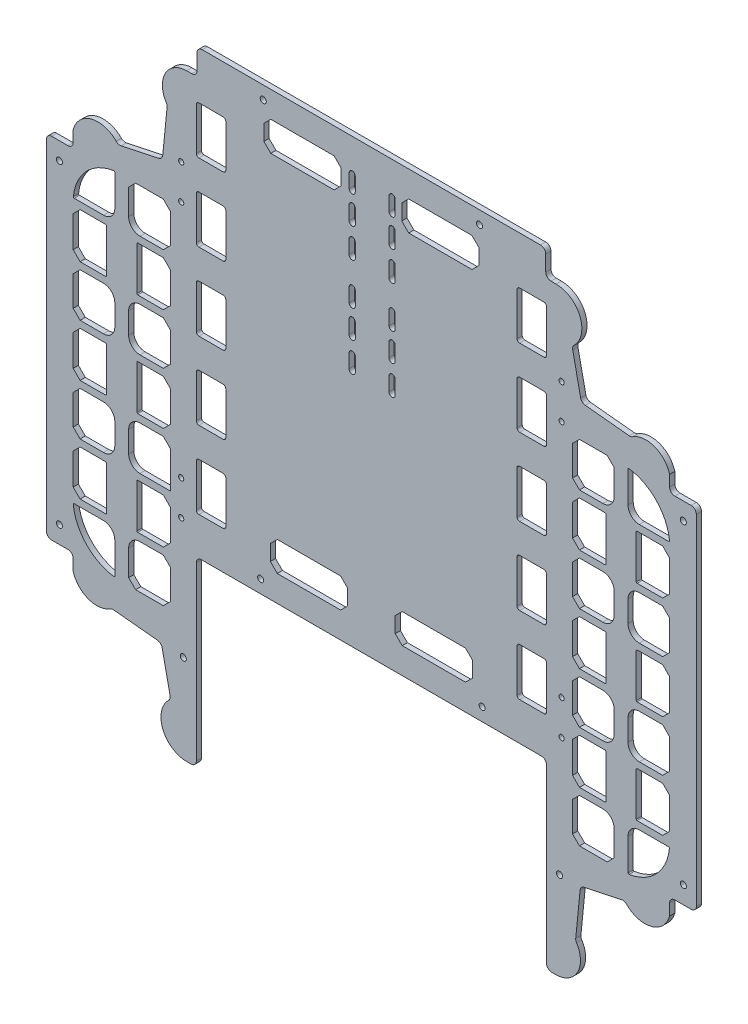
from build123d import *

# Parameters (mm, degrees)
RESSALTO_EXTRUS_O1_DEPTH = 6
FILETE1_R                = 6
CORTE_EXTRUS_O1_DEPTH    = 10
FILETE2_R                = 6
ESBO_O4_W                = 38.482345016
ESBO_O4_H                = 52
ESBO_O4_W_2              = 38.482345017
CORTE_EXTRUS_O2_DEPTH    = 931.073254939
FILETE3_R                = 55
FILETE4_R                = 13
CHANFRO1_SIZE            = 8
FILETE5_R                = 1
ESBO_O8_W                = 34
ESBO_O8_H                = 55
CORTE_EXTRUS_O4_DEPTH    = 931.073254939
FILETE6_R                = 3
ESBO_O9_W                = 89
ESBO_O9_H                = 34
CORTE_EXTRUS_O5_DEPTH    = 931.073254939
CHANFRO2_SIZE            = 8
CHANFRO3_SIZE            = 8
CORTE_EXTRUS_O6_DEPTH    = 931.073254939
ESBO_O11_R               = 3
CORTE_EXTRUS_O7_DEPTH    = 931.073254939
ESBO_O12_R               = 3.5
CORTE_EXTRUS_O8_DEPTH    = 931.073254939


with BuildPart() as part:
    # Esboço1 → Ressalto-extrusão1 (new body)
    with BuildSketch(Plane.XY):
        with BuildLine():
            Line((306.342806047, -674.493319609), (275.520600999, -674.493319609))
            Line((275.520600999, -674.493319609), (275.520600999, -717.778646353))
            Line((275.520600999, -717.778646353), (233.520600999, -717.778646353))
            ThreePointArc((233.520600999, -717.778646353), (192.534924195, -734.755469548), (175.558100999, -775.741146353))
            Line((175.558100999, -775.741146353), (175.558100999, -817.741146353))
            Line((175.558100999, -817.741146353), (133.558100999, -817.741146353))
            Line((133.558100999, -817.741146353), (133.558100999, -607.741146353))
            Line((133.558100999, -607.741146353), (-270.272488906, -607.741146353))
            Line((-270.272488906, -607.741146353), (-270.272488906, -817.741146353))
            Line((-270.272488906, -817.741146353), (-312.272488906, -817.741146353))
            Line((-312.272488906, -817.741146353), (-312.272488906, -775.741146353))
            ThreePointArc((-312.272488906, -775.741146353), (-329.249312101, -734.755469548), (-370.234988906, -717.778646353))
            Line((-370.234988906, -717.778646353), (-412.234988906, -717.778646353))
            Line((-412.234988906, -717.778646353), (-412.234988906, -674.493319609))
            Line((-412.234988906, -674.493319609), (-443.057193953, -674.493319609))
            Line((-443.057193953, -674.493319609), (-443.057193953, -271.188973097))
            Line((-443.057193953, -271.188973097), (-412.234988906, -271.188973097))
            Line((-412.234988906, -271.188973097), (-412.234988906, -227.903646353))
            Line((-412.234988906, -227.903646353), (-370.234988906, -227.903646353))
            ThreePointArc((-370.234988906, -227.903646353), (-329.249312101, -210.926823158), (-312.272488906, -169.941146353))
            Line((-312.272488906, -169.941146353), (-312.272488906, -127.941146353))
            Line((-312.272488906, -127.941146353), (-270.272488906, -127.941146353))
            Line((-270.272488906, -127.941146353), (-269.391871615, -127.941146353))
            Line((-269.391871615, -127.941146353), (-269.391871615, -97.941146353))
            Line((-269.391871615, -97.941146353), (132.677483708, -97.941146353))
            Line((132.677483708, -97.941146353), (132.677483708, -127.941146353))
            Line((132.677483708, -127.941146353), (133.558100999, -127.941146353))
            Line((133.558100999, -127.941146353), (175.558100999, -127.941146353))
            Line((175.558100999, -127.941146353), (175.558100999, -169.941146353))
            ThreePointArc((175.558100999, -169.941146353), (192.534924195, -210.926823158), (233.520600999, -227.903646353))
            Line((233.520600999, -227.903646353), (275.520600999, -227.903646353))
            Line((275.520600999, -227.903646353), (275.520600999, -271.188973097))
            Line((275.520600999, -271.188973097), (306.342806047, -271.188973097))
            Line((306.342806047, -271.188973097), (306.342806047, -674.493319609))
        make_face()
    extrude(amount=RESSALTO_EXTRUS_O1_DEPTH)

    # Filete1
    filete1_edges = [part.edges().sort_by_distance(p)[0] for p in [
        (306.342806047, -674.493319609, 3),
        (275.520600999, -674.493319609, 3),
        (275.520600999, -717.778646353, 3),
        (175.558100999, -817.741146353, 3),
        (133.558100999, -817.741146353, 3),
        (133.558100999, -607.741146353, 3),
        (-270.272488906, -607.741146353, 3),
        (-270.272488906, -817.741146353, 3),
        (-312.272488906, -817.741146353, 3),
        (-412.234988906, -717.778646353, 3),
        (-412.234988906, -674.493319609, 3),
        (-443.057193953, -674.493319609, 3),
        (-443.057193953, -271.188973097, 3),
        (-412.234988906, -271.188973097, 3),
        (-412.234988906, -227.903646353, 3),
        (-312.272488906, -127.941146353, 3),
        (-269.391871615, -127.941146353, 3),
        (-269.391871615, -97.941146353, 3),
        (132.677483708, -97.941146353, 3),
        (175.558100999, -127.941146353, 3),
        (275.520600999, -227.903646353, 3),
        (275.520600999, -271.188973097, 3),
        (306.342806047, -271.188973097, 3),
    ]]
    fillet(filete1_edges, radius=FILETE1_R)

    # Esboço2 → Corte-extrusão1 (cut)
    with BuildSketch(Plane(origin=(0, 0, 0), x_dir=(-1, 0, 0), z_dir=(0, 0, -1))):
        with BuildLine():
            Line((309.447448128, -230.621094148), (360.422080204, -241.420804334))
            ThreePointArc((360.422080204, -241.420804334), (393.362675526, -231.794749334), (413.257193953, -259.758152052))
            ThreePointArc((413.257193953, -259.758152052), (384.010212601, -157.179553298), (281.423154639, -127.962257404))
            ThreePointArc((281.423154639, -127.962257404), (306.518723232, -143.794354152), (303.702517001, -173.332665426))
            Line((303.702517001, -173.332665426), (309.447448128, -230.621094148))
        make_face()
        with BuildLine():
            Line((310.577246158, -713.931400527), (299.777535973, -764.906032604))
            ThreePointArc((299.777535973, -764.906032604), (309.403590972, -797.846627926), (281.440188254, -817.741146353))
            ThreePointArc((281.440188254, -817.741146353), (384.018787009, -788.494165001), (413.236082902, -685.907107039))
            ThreePointArc((413.236082902, -685.907107039), (397.403986154, -711.002675631), (367.865674881, -708.186469401))
            Line((367.865674881, -708.186469401), (310.577246158, -713.931400527))
        make_face()
        with BuildLine():
            Line((-172.733060221, -715.061198558), (-223.707692298, -704.261488372))
            ThreePointArc((-223.707692298, -704.261488372), (-256.648287619, -713.887543372), (-276.542806047, -685.924140654))
            ThreePointArc((-276.542806047, -685.924140654), (-247.295824695, -788.502739408), (-144.708766733, -817.720035302))
            ThreePointArc((-144.708766733, -817.720035302), (-169.804335325, -801.887938554), (-166.988129095, -772.34962728))
            Line((-166.988129095, -772.34962728), (-172.733060221, -715.061198558))
        make_face()
        with BuildLine():
            Line((-173.862858252, -231.750892179), (-163.063148066, -180.776260102))
            ThreePointArc((-163.063148066, -180.776260102), (-172.689203065, -147.83566478), (-144.725800348, -127.941146353))
            ThreePointArc((-144.725800348, -127.941146353), (-247.304399102, -157.188127705), (-276.521694995, -259.775185667))
            ThreePointArc((-276.521694995, -259.775185667), (-260.689598247, -234.679617075), (-231.151286974, -237.495823305))
            Line((-231.151286974, -237.495823305), (-173.862858252, -231.750892179))
        make_face()
    extrude(amount=-CORTE_EXTRUS_O1_DEPTH, mode=Mode.SUBTRACT)

    # Filete2
    filete2_edges = [part.edges().sort_by_distance(p)[0] for p in [
        (-367.865674881, -708.186469401, 3),
        (-299.777535973, -764.906032604, 3),
        (-310.577246158, -713.931400527, 3),
        (223.707692298, -704.261488372, 3),
        (172.733060221, -715.061198558, 3),
        (166.988129095, -772.34962728, 3),
        (231.151286974, -237.495823305, 3),
        (163.063148066, -180.776260102, 3),
        (173.862858252, -231.750892179, 3),
        (-360.422080204, -241.420804334, 3),
        (-309.447448128, -230.621094148, 3),
        (-303.702517001, -173.332665426, 3),
        (132.677483708, -127.941146353, 3),
    ]]
    fillet(filete2_edges, radius=FILETE2_R)

    # Esboço4 → Corte-extrusão2 (cut, through all)
    with BuildSketch(Plane(origin=(0, 0, 0), x_dir=(-1, 0, 0), z_dir=(0, 0, -1))):
        Polygon((373.754833922, -625.078646353), (364.254833922, -625.078646353), (364.254833922, -675.578646353), (412.237178938, -675.578646353), (412.237178938, -625.078646353), align=None)
        with Locations((392.99600643, -591.078646353)):
            Rectangle(ESBO_O4_W, ESBO_O4_H)
        Polygon((373.754833922, -557.078646353), (364.254833922, -557.078646353), (364.254833922, -506.578646353), (373.754833922, -506.578646353), (412.237178938, -506.578646353), (412.237178938, -557.078646353), align=None)
        with Locations((319.513661414, -591.078646353)):
            Rectangle(ESBO_O4_W, ESBO_O4_H)
        with Locations((392.99600643, -472.578646353)):
            Rectangle(ESBO_O4_W, ESBO_O4_H)
        Polygon((373.754833922, -438.578646353), (364.254833922, -438.578646353), (364.254833922, -388.078646353), (373.754833922, -388.078646353), (412.237178938, -388.078646353), (412.237178938, -438.578646353), align=None)
        with Locations((319.513661414, -472.578646353)):
            Rectangle(ESBO_O4_W, ESBO_O4_H)
        with Locations((392.99600643, -354.078646353)):
            Rectangle(ESBO_O4_W, ESBO_O4_H)
        Polygon((373.754833922, -320.078646353), (364.254833922, -320.078646353), (364.254833922, -269.578646353), (412.237178938, -269.578646353), (412.237178938, -320.078646353), align=None)
        with Locations((319.513661414, -354.078646353)):
            Rectangle(ESBO_O4_W, ESBO_O4_H)
        Polygon((300.272488906, -269.578646353), (348.254833922, -269.578646353), (348.254833922, -320.078646353), (338.754833922, -320.078646353), (300.272488906, -320.078646353), align=None)
        Polygon((300.272488906, -675.578646353), (348.254833922, -675.578646353), (348.254833922, -625.078646353), (338.754833922, -625.078646353), (300.272488906, -625.078646353), align=None)
        Polygon((348.254833922, -438.578646353), (348.254833922, -388.078646353), (338.754833922, -388.078646353), (300.272488906, -388.078646353), (300.272488906, -438.578646353), (338.754833922, -438.578646353), align=None)
        Polygon((348.254833922, -557.078646353), (348.254833922, -506.578646353), (338.754833922, -506.578646353), (300.272488906, -506.578646353), (300.272488906, -557.078646353), (338.754833922, -557.078646353), align=None)
        Polygon((-227.540446015, -675.578646353), (-275.522791032, -675.578646353), (-275.522791032, -625.078646353), (-237.040446015, -625.078646353), (-227.540446015, -625.078646353), align=None)
        Polygon((-163.558100999, -625.078646353), (-163.558100999, -675.578646353), (-211.540446015, -675.578646353), (-211.540446015, -625.078646353), (-202.040446015, -625.078646353), align=None)
        with Locations((-182.799273507, -354.078646353)):
            Rectangle(ESBO_O4_W, ESBO_O4_H)
        with Locations((-182.799273507, -591.078646353)):
            Rectangle(ESBO_O4_W, ESBO_O4_H)
        with Locations((-256.281618524, -354.078646353)):
            Rectangle(ESBO_O4_W_2, ESBO_O4_H)
        with Locations((-256.281618524, -591.078646353)):
            Rectangle(ESBO_O4_W_2, ESBO_O4_H)
        with Locations((-182.799273507, -472.578646353)):
            Rectangle(ESBO_O4_W, ESBO_O4_H)
        Polygon((-275.522791032, -506.578646353), (-275.522791032, -557.078646353), (-237.040446015, -557.078646353), (-227.540446015, -557.078646353), (-227.540446015, -506.578646353), (-237.040446015, -506.578646353), align=None)
        with Locations((-256.281618524, -472.578646353)):
            Rectangle(ESBO_O4_W_2, ESBO_O4_H)
        Polygon((-163.558100999, -506.578646353), (-163.558100999, -557.078646353), (-202.040446015, -557.078646353), (-211.540446015, -557.078646353), (-211.540446015, -506.578646353), (-202.040446015, -506.578646353), align=None)
        Polygon((-275.522791032, -388.078646353), (-275.522791032, -438.578646353), (-237.040446015, -438.578646353), (-227.540446015, -438.578646353), (-227.540446015, -388.078646353), (-237.040446015, -388.078646353), align=None)
        Polygon((-163.558100999, -388.078646353), (-163.558100999, -438.578646353), (-202.040446015, -438.578646353), (-211.540446015, -438.578646353), (-211.540446015, -388.078646353), (-202.040446015, -388.078646353), align=None)
        Polygon((-227.540446015, -269.578646353), (-275.522791032, -269.578646353), (-275.522791032, -320.078646353), (-237.040446015, -320.078646353), (-227.540446015, -320.078646353), align=None)
        Polygon((-202.040446015, -320.078646353), (-163.558100999, -320.078646353), (-163.558100999, -269.578646353), (-211.540446015, -269.578646353), (-211.540446015, -320.078646353), align=None)
    extrude(amount=-CORTE_EXTRUS_O2_DEPTH, mode=Mode.SUBTRACT)

    # Filete3
    # the kernel refuses this fillet: 55 mm, written as the material it adds along each edge
    with BuildSketch(Plane(origin=(-412.237178938, -675.578646353, 0), x_dir=(1, 0, 0), z_dir=(0, 0, 1)), Plane(origin=(275.522791032, -269.578646353, 0), x_dir=(-1, 0, 0), z_dir=(0, 0, 1))) as filete3_piece_1:
        with BuildLine():
            CenterArc((54.815599969, 55), FILETE3_R, 184.693082555, 85.306917445)
            Line((0, 50.5), (0, 0))
            Line((0, 0), (54.815599969, 0))
        make_face()
    extrude(amount=6)
    with BuildSketch(Plane(origin=(-412.237178938, -269.578646353, 0), x_dir=(0, -1, 0), z_dir=(0, 0, 1)), Plane(origin=(275.522791032, -675.578646353, 0), x_dir=(0, 1, 0), z_dir=(0, 0, 1))) as filete3_piece_2:
        with BuildLine():
            CenterArc((54.550458463, 55), FILETE3_R, 187.330565034, 82.669434966)
            Line((0, 47.982345016), (0, 0))
            Line((0, 0), (54.550458463, 0))
        make_face()
    extrude(amount=6)

    # Filete4
    filete4_edges = [part.edges().sort_by_distance(p)[0] for p in [
        (227.540446015, -625.078646353, 3),
        (211.540446015, -625.078646353, 3),
        (211.540446015, -557.078646353, 3),
        (211.540446015, -506.578646353, 3),
        (-348.254833922, -388.078646353, 3),
        (-348.254833922, -438.578646353, 3),
        (-348.254833922, -625.078646353, 3),
        (-364.254833922, -557.078646353, 3),
        (-364.254833922, -506.578646353, 3),
        (-348.254833922, -506.578646353, 3),
        (-348.254833922, -557.078646353, 3),
        (-364.254833922, -320.078646353, 3),
        (-348.254833922, -320.078646353, 3),
        (-364.254833922, -438.578646353, 3),
        (-364.254833922, -388.078646353, 3),
        (211.540446015, -320.078646353, 3),
        (211.540446015, -388.078646353, 3),
        (211.540446015, -438.578646353, 3),
        (227.540446015, -320.078646353, 3),
        (227.540446015, -438.578646353, 3),
        (227.540446015, -388.078646353, 3),
        (227.540446015, -506.578646353, 3),
        (227.540446015, -557.078646353, 3),
        (-364.254833922, -625.078646353, 3),
    ]]
    fillet(filete4_edges, radius=FILETE4_R)

    # Chanfro1
    chanfro1_edges = [part.edges().sort_by_distance(p)[0] for p in [
        (-412.237178938, -446.578646353, 3),
        (-412.237178938, -498.578646353, 3),
        (-300.272488906, -498.578646353, 3),
        (-300.272488906, -446.578646353, 3),
        (-412.237178938, -565.078646353, 3),
        (-412.237178938, -617.078646353, 3),
        (163.558100999, -675.578646353, 3),
        (211.540446015, -675.578646353, 3),
        (163.558100999, -625.078646353, 3),
        (-412.237178938, -328.078646353, 3),
        (-412.237178938, -380.078646353, 3),
        (163.558100999, -506.578646353, 3),
        (163.558100999, -557.078646353, 3),
        (-300.272488906, -380.078646353, 3),
        (-300.272488906, -328.078646353, 3),
        (-300.272488906, -438.578646353, 3),
        (-300.272488906, -388.078646353, 3),
        (-300.272488906, -625.078646353, 3),
        (-348.254833922, -675.578646353, 3),
        (-300.272488906, -675.578646353, 3),
        (-412.237178938, -557.078646353, 3),
        (-412.237178938, -506.578646353, 3),
        (-300.272488906, -506.578646353, 3),
        (-300.272488906, -617.078646353, 3),
        (-300.272488906, -565.078646353, 3),
        (-300.272488906, -320.078646353, 3),
        (-300.272488906, -269.578646353, 3),
        (-348.254833922, -269.578646353, 3),
        (-412.237178938, -438.578646353, 3),
        (-412.237178938, -388.078646353, 3),
        (211.540446015, -269.578646353, 3),
        (163.558100999, -269.578646353, 3),
        (163.558100999, -320.078646353, 3),
        (163.558100999, -388.078646353, 3),
        (163.558100999, -438.578646353, 3),
        (275.522791032, -617.078646353, 3),
        (275.522791032, -565.078646353, 3),
        (163.558100999, -565.078646353, 3),
        (163.558100999, -617.078646353, 3),
        (275.522791032, -380.078646353, 3),
        (275.522791032, -328.078646353, 3),
        (163.558100999, -328.078646353, 3),
        (163.558100999, -380.078646353, 3),
        (275.522791032, -438.578646353, 3),
        (275.522791032, -388.078646353, 3),
        (275.522791032, -498.578646353, 3),
        (275.522791032, -446.578646353, 3),
        (275.522791032, -557.078646353, 3),
        (275.522791032, -506.578646353, 3),
        (163.558100999, -446.578646353, 3),
        (163.558100999, -498.578646353, 3),
    ]]
    chamfer(chanfro1_edges, length=CHANFRO1_SIZE)

    # Filete5
    filete5_edges = [part.edges().sort_by_distance(p)[0] for p in [
        (275.373440857, -625.078646353, 3),
        (227.540446015, -675.578646353, 3),
        (-373.754833922, -446.578646353, 3),
        (-373.754833922, -498.578646353, 3),
        (-338.754833922, -498.578646353, 3),
        (-338.754833922, -446.578646353, 3),
        (-373.754833922, -565.078646353, 3),
        (-373.754833922, -617.078646353, 3),
        (-373.754833922, -328.078646353, 3),
        (-373.754833922, -380.078646353, 3),
        (-338.754833922, -380.078646353, 3),
        (-338.754833922, -328.078646353, 3),
        (-338.754833922, -617.078646353, 3),
        (-338.754833922, -565.078646353, 3),
        (-364.254833922, -269.578646353, 3),
        (237.040446015, -565.078646353, 3),
        (237.040446015, -617.078646353, 3),
        (202.040446015, -617.078646353, 3),
        (202.040446015, -565.078646353, 3),
        (237.040446015, -328.078646353, 3),
        (237.040446015, -380.078646353, 3),
        (275.522791032, -320.078646353, 3),
        (202.040446015, -380.078646353, 3),
        (202.040446015, -328.078646353, 3),
        (237.040446015, -446.578646353, 3),
        (237.040446015, -498.578646353, 3),
        (202.040446015, -498.578646353, 3),
        (202.040446015, -446.578646353, 3),
        (-412.237178938, -625.078646353, 3),
        (-364.254833922, -675.152510306, 3),
        (-412.087828763, -320.078646353, 3),
        (227.540446015, -270.0047824, 3),
    ]]
    fillet(filete5_edges, radius=FILETE5_R)

    # Esboço8 → Corte-extrusão4 (cut, through all)
    with BuildSketch(Plane(origin=(0, 0, 0), x_dir=(-1, 0, 0), z_dir=(0, 0, -1))):
        with Locations((253.272488906, -536.441146353)):
            Rectangle(ESBO_O8_W, ESBO_O8_H)
        with Locations((253.272488906, -180.441146353)):
            Rectangle(ESBO_O8_W, ESBO_O8_H)
        with Locations((253.272488906, -447.441146353)):
            Rectangle(ESBO_O8_W, ESBO_O8_H)
        with Locations((253.272488906, -358.441146353)):
            Rectangle(ESBO_O8_W, ESBO_O8_H)
        with Locations((253.272488906, -269.441146353)):
            Rectangle(ESBO_O8_W, ESBO_O8_H)
        with Locations((-116.558100999, -269.441146353)):
            Rectangle(ESBO_O8_W, ESBO_O8_H)
        with Locations((-116.558100999, -358.441146353)):
            Rectangle(ESBO_O8_W, ESBO_O8_H)
        with Locations((-116.558100999, -447.441146353)):
            Rectangle(ESBO_O8_W, ESBO_O8_H)
        with Locations((-116.558100999, -180.441146353)):
            Rectangle(ESBO_O8_W, ESBO_O8_H)
        with Locations((-116.558100999, -536.441146353)):
            Rectangle(ESBO_O8_W, ESBO_O8_H)
    extrude(amount=-CORTE_EXTRUS_O4_DEPTH, mode=Mode.SUBTRACT)

    # Filete6
    filete6_edges = [part.edges().sort_by_distance(p)[0] for p in [
        (133.558100999, -563.941146353, 3),
        (133.558100999, -508.941146353, 3),
        (99.558100999, -508.941146353, 3),
        (99.558100999, -563.941146353, 3),
        (99.558100999, -296.941146353, 3),
        (133.558100999, -296.941146353, 3),
        (133.558100999, -241.941146353, 3),
        (99.558100999, -241.941146353, 3),
        (133.558100999, -385.941146353, 3),
        (133.558100999, -330.941146353, 3),
        (99.558100999, -330.941146353, 3),
        (99.558100999, -385.941146353, 3),
        (133.558100999, -207.941146353, 3),
        (133.558100999, -152.941146353, 3),
        (99.558100999, -152.941146353, 3),
        (99.558100999, -207.941146353, 3),
        (133.558100999, -474.941146353, 3),
        (133.558100999, -419.941146353, 3),
        (99.558100999, -419.941146353, 3),
        (99.558100999, -474.941146353, 3),
        (-270.272488906, -152.941146353, 3),
        (-270.272488906, -207.941146353, 3),
        (-236.272488906, -207.941146353, 3),
        (-236.272488906, -152.941146353, 3),
        (-270.272488906, -419.941146353, 3),
        (-270.272488906, -474.941146353, 3),
        (-236.272488906, -474.941146353, 3),
        (-236.272488906, -419.941146353, 3),
        (-270.272488906, -330.941146353, 3),
        (-270.272488906, -385.941146353, 3),
        (-236.272488906, -385.941146353, 3),
        (-236.272488906, -330.941146353, 3),
        (-270.272488906, -241.941146353, 3),
        (-270.272488906, -296.941146353, 3),
        (-236.272488906, -296.941146353, 3),
        (-236.272488906, -241.941146353, 3),
        (-270.272488906, -508.941146353, 3),
        (-270.272488906, -563.941146353, 3),
        (-236.272488906, -563.941146353, 3),
        (-236.272488906, -508.941146353, 3),
    ]]
    fillet(filete6_edges, radius=FILETE6_R)

    # Esboço9 → Corte-extrusão5 (cut, through all)
    with BuildSketch(Plane.XY.offset(6)):
        with Locations((-147.857193953, -144.941146353)):
            Rectangle(ESBO_O9_W, ESBO_O9_H)
        with Locations((11.142806047, -144.941146353)):
            Rectangle(ESBO_O9_W, ESBO_O9_H)
        with Locations((3.642806047, -560.741146353)):
            Rectangle(ESBO_O9_W, ESBO_O9_H)
        with Locations((-140.357193953, -560.741146353)):
            Rectangle(ESBO_O9_W, ESBO_O9_H)
    extrude(amount=-CORTE_EXTRUS_O5_DEPTH, mode=Mode.SUBTRACT)

    # Chanfro2
    chanfro2_edges = [part.edges().sort_by_distance(p)[0] for p in [
        (-33.357193953, -161.941146353, 3),
        (-33.357193953, -127.941146353, 3),
        (55.642806047, -127.941146353, 3),
        (55.642806047, -161.941146353, 3),
        (-192.357193953, -161.941146353, 3),
        (-192.357193953, -127.941146353, 3),
        (-103.357193953, -127.941146353, 3),
        (-103.357193953, -161.941146353, 3),
    ]]
    chamfer(chanfro2_edges, length=CHANFRO2_SIZE)

    # Chanfro3
    chanfro3_edges = [part.edges().sort_by_distance(p)[0] for p in [
        (-184.857193953, -543.741146353, 3),
        (-95.857193953, -543.741146353, 3),
        (-95.857193953, -577.741146353, 3),
        (-184.857193953, -577.741146353, 3),
        (-40.857193953, -577.741146353, 3),
        (-40.857193953, -543.741146353, 3),
        (48.142806047, -543.741146353, 3),
        (48.142806047, -577.741146353, 3),
    ]]
    chamfer(chanfro3_edges, length=CHANFRO3_SIZE)

    # Esboço10 → Corte-extrusão6 (cut, through all)
    with BuildSketch(Plane.XY.offset(6)):
        with BuildLine():
            Line((-40.972488906, -135.941146353), (-40.972488906, -151.941146353))
            ThreePointArc((-40.972488906, -151.941146353), (-44.472488906, -155.441146353), (-47.972488906, -151.941146353))
            Line((-47.972488906, -151.941146353), (-47.972488906, -135.941146353))
            ThreePointArc((-47.972488906, -135.941146353), (-44.472488906, -132.441146353), (-40.972488906, -135.941146353))
        make_face()
        with BuildLine():
            Line((-40.876349659, -167.941146353), (-40.876349659, -183.941146353))
            ThreePointArc((-40.876349659, -183.941146353), (-44.472488906, -187.5372856), (-48.068628153, -183.941146353))
            Line((-48.068628153, -183.941146353), (-48.068628153, -167.941146353))
            ThreePointArc((-48.068628153, -167.941146353), (-44.472488906, -164.345007106), (-40.876349659, -167.941146353))
        make_face()
        with BuildLine():
            Line((-86.972488906, -135.941146353), (-86.972488906, -151.941146353))
            ThreePointArc((-86.972488906, -151.941146353), (-90.472488906, -155.441146353), (-93.972488906, -151.941146353))
            Line((-93.972488906, -151.941146353), (-93.972488906, -135.941146353))
            ThreePointArc((-93.972488906, -135.941146353), (-90.472488906, -132.441146353), (-86.972488906, -135.941146353))
        make_face()
        with BuildLine():
            Line((-86.876349659, -167.941146353), (-86.876349659, -183.941146353))
            ThreePointArc((-86.876349659, -183.941146353), (-90.472488906, -187.5372856), (-94.068628153, -183.941146353))
            Line((-94.068628153, -183.941146353), (-94.068628153, -167.941146353))
            ThreePointArc((-94.068628153, -167.941146353), (-90.472488906, -164.345007106), (-86.876349659, -167.941146353))
        make_face()
        with BuildLine():
            Line((-86.972488906, -249.941146353), (-86.972488906, -265.941146353))
            ThreePointArc((-86.972488906, -265.941146353), (-90.472488906, -269.441146353), (-93.972488906, -265.941146353))
            Line((-93.972488906, -265.941146353), (-93.972488906, -249.941146353))
            ThreePointArc((-93.972488906, -249.941146353), (-90.472488906, -246.441146353), (-86.972488906, -249.941146353))
        make_face()
        with BuildLine():
            Line((-86.876349659, -281.941146353), (-86.876349659, -297.941146353))
            ThreePointArc((-86.876349659, -297.941146353), (-90.472488906, -301.5372856), (-94.068628153, -297.941146353))
            Line((-94.068628153, -297.941146353), (-94.068628153, -281.941146353))
            ThreePointArc((-94.068628153, -281.941146353), (-90.472488906, -278.345007106), (-86.876349659, -281.941146353))
        make_face()
        with BuildLine():
            Line((-40.972488906, -249.941146353), (-40.972488906, -265.941146353))
            ThreePointArc((-40.972488906, -265.941146353), (-44.472488906, -269.441146353), (-47.972488906, -265.941146353))
            Line((-47.972488906, -265.941146353), (-47.972488906, -249.941146353))
            ThreePointArc((-47.972488906, -249.941146353), (-44.472488906, -246.441146353), (-40.972488906, -249.941146353))
        make_face()
        with BuildLine():
            Line((-40.876349659, -281.941146353), (-40.876349659, -297.941146353))
            ThreePointArc((-40.876349659, -297.941146353), (-44.472488906, -301.5372856), (-48.068628153, -297.941146353))
            Line((-48.068628153, -297.941146353), (-48.068628153, -281.941146353))
            ThreePointArc((-48.068628153, -281.941146353), (-44.472488906, -278.345007106), (-40.876349659, -281.941146353))
        make_face()
        with BuildLine():
            Line((-40.876349659, -201.941146353), (-40.876349659, -217.941146353))
            ThreePointArc((-40.876349659, -217.941146353), (-44.472488906, -221.5372856), (-48.068628153, -217.941146353))
            Line((-48.068628153, -217.941146353), (-48.068628153, -201.941146353))
            ThreePointArc((-48.068628153, -201.941146353), (-44.472488906, -198.345007106), (-40.876349659, -201.941146353))
        make_face()
        with BuildLine():
            Line((-86.876349659, -201.941146353), (-86.876349659, -217.941146353))
            ThreePointArc((-86.876349659, -217.941146353), (-90.472488906, -221.5372856), (-94.068628153, -217.941146353))
            Line((-94.068628153, -217.941146353), (-94.068628153, -201.941146353))
            ThreePointArc((-94.068628153, -201.941146353), (-90.472488906, -198.345007106), (-86.876349659, -201.941146353))
        make_face()
        with BuildLine():
            Line((-86.876349659, -315.941146353), (-86.876349659, -331.941146353))
            ThreePointArc((-86.876349659, -331.941146353), (-90.472488906, -335.5372856), (-94.068628153, -331.941146353))
            Line((-94.068628153, -331.941146353), (-94.068628153, -315.941146353))
            ThreePointArc((-94.068628153, -315.941146353), (-90.472488906, -312.345007106), (-86.876349659, -315.941146353))
        make_face()
        with BuildLine():
            Line((-40.876349659, -315.941146353), (-40.876349659, -331.941146353))
            ThreePointArc((-40.876349659, -331.941146353), (-44.472488906, -335.5372856), (-48.068628153, -331.941146353))
            Line((-48.068628153, -331.941146353), (-48.068628153, -315.941146353))
            ThreePointArc((-48.068628153, -315.941146353), (-44.472488906, -312.345007106), (-40.876349659, -315.941146353))
        make_face()
    extrude(amount=-CORTE_EXTRUS_O6_DEPTH, mode=Mode.SUBTRACT)

    # Esboço11 → Corte-extrusão7 (cut, through all)
    with BuildSketch(Plane.XY.offset(6)):
        with Locations((150.980538294, -222.078646353)):
            Circle(ESBO_O11_R)
        with Locations((150.980538294, -262.078646353)):
            Circle(ESBO_O11_R)
        with Locations((150.980538294, -537.578646353)):
            Circle(ESBO_O11_R)
        with Locations((150.980538294, -577.578646353)):
            Circle(ESBO_O11_R)
        with Locations(Location((-287.694926201, -577.578646353, 0), (0, 0, 180))):
            Circle(ESBO_O11_R)
        with Locations(Location((-287.694926201, -537.578646353, 0), (0, 0, 180))):
            Circle(ESBO_O11_R)
        with Locations(Location((-287.694926201, -262.078646353, 0), (0, 0, 180))):
            Circle(ESBO_O11_R)
        with Locations(Location((-287.694926201, -222.078646353, 0), (0, 0, 180))):
            Circle(ESBO_O11_R)
    extrude(amount=-CORTE_EXTRUS_O7_DEPTH, mode=Mode.SUBTRACT)

    # Esboço12 → Corte-extrusão8 (cut, through all)
    with BuildSketch(Plane.XY.offset(6)):
        with Locations((291.342806047, -291.188973097)):
            Circle(ESBO_O12_R)
        with Locations((291.342806047, -654.493319609)):
            Circle(ESBO_O12_R)
        with Locations((148.558100999, -715.741146353)):
            Circle(ESBO_O12_R)
        with Locations((59.342806047, -592.741146353)):
            Circle(ESBO_O12_R)
        with Locations((56.342806047, -112.941146353)):
            Circle(ESBO_O12_R)
        with Locations(Location((-193.057193953, -112.941146353, 0), (0, 0, 180))):
            Circle(ESBO_O12_R)
        with Locations(Location((-196.057193953, -592.741146353, 0), (0, 0, 180))):
            Circle(ESBO_O12_R)
        with Locations(Location((-285.272488906, -715.741146353, 0), (0, 0, 180))):
            Circle(ESBO_O12_R)
        with Locations(Location((-428.057193953, -654.493319609, 0), (0, 0, 180))):
            Circle(ESBO_O12_R)
        with Locations(Location((-428.057193953, -291.188973097, 0), (0, 0, 180))):
            Circle(ESBO_O12_R)
    extrude(amount=-CORTE_EXTRUS_O8_DEPTH, mode=Mode.SUBTRACT)


solid = part.part
